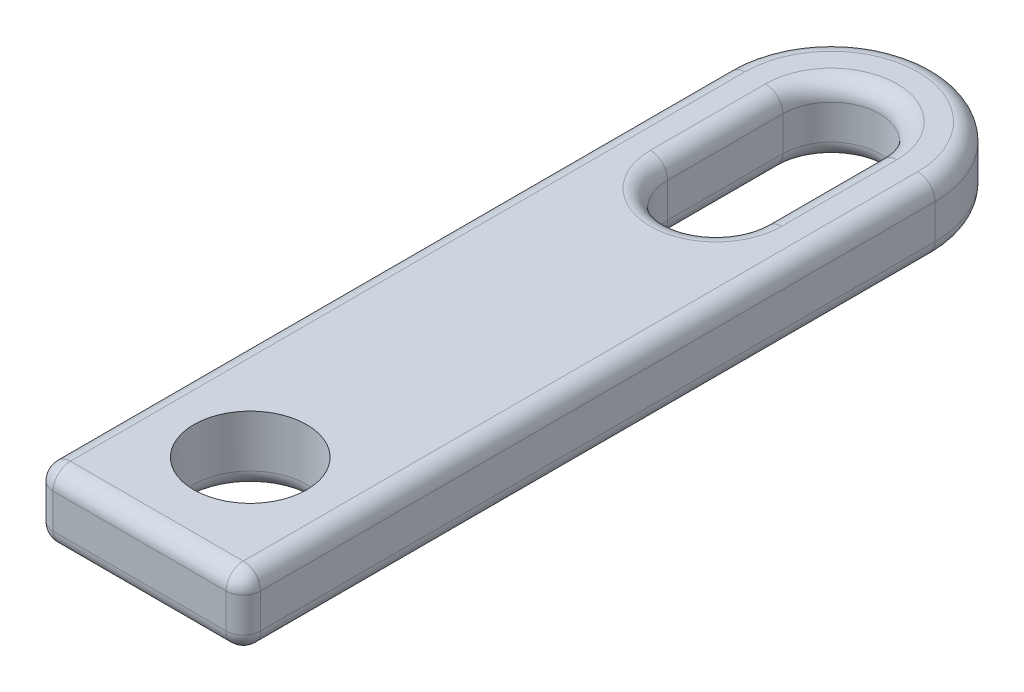
from build123d import *

# Parameters (mm, degrees)
SKETCH1_R           = 2.45
BOSS_EXTRUDE1_DEPTH = 3
FILLET1_R           = 0.75


with BuildPart() as part:
    # Sketch1 → Boss-Extrude1 (new body)
    with BuildSketch(Plane(origin=(0, 0, 0), x_dir=(1, 0, 0), z_dir=(0, 1, 0))):
        with BuildLine():
            Line((-4.5, -37.44915748), (4.5, -37.44915748))
            Line((4.5, -37.44915748), (4.5, -7.44915748))
            ThreePointArc((4.5, -7.44915748), (0, -2.94915748), (-4.5, -7.44915748))
            Line((-4.5, -7.44915748), (-4.5, -37.44915748))
        make_face()
        with Locations((0, -32.64915748)):
            Circle(SKETCH1_R, mode=Mode.SUBTRACT)
        with BuildLine():
            Line((2.1, -7.44915748), (2.1, -12.44915748))
            ThreePointArc((2.1, -12.44915748), (0, -14.54915748), (-2.1, -12.44915748))
            Line((-2.1, -12.44915748), (-2.1, -7.44915748))
            ThreePointArc((-2.1, -7.44915748), (0, -5.34915748), (2.1, -7.44915748))
        make_face(mode=Mode.SUBTRACT)
    extrude(amount=BOSS_EXTRUDE1_DEPTH)

    # Fillet1
    fillet1_edges = [part.edges().sort_by_distance(p)[0] for p in [
        (0, 3, 37.44915748),
        (2.1, 0, 9.94915748),
        (0, 0, 14.54915748),
        (-2.1, 0, 9.94915748),
        (0, 0, 5.34915748),
        (0, 0, 37.44915748),
        (0, 3, 2.94915748),
        (0, 0, 2.94915748),
        (0, 3, 5.34915748),
        (2.1, 3, 9.94915748),
        (0, 3, 14.54915748),
        (-2.1, 3, 9.94915748),
        (-2.45, 0, 32.64915748),
        (-4.5, 3, 22.44915748),
        (4.5, 3, 22.44915748),
        (-4.5, 1.5, 37.44915748),
        (4.5, 1.5, 37.44915748),
        (-4.5, 0, 22.44915748),
        (4.5, 0, 22.44915748),
    ]]
    fillet(fillet1_edges, radius=FILLET1_R)


solid = part.part
